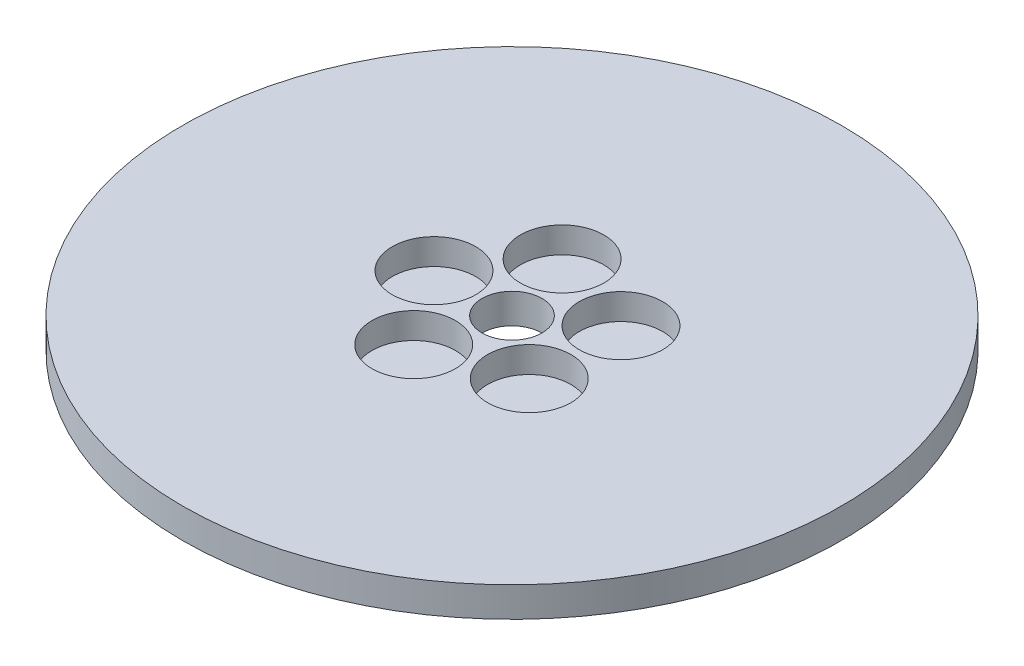
from build123d import *

# Parameters (mm, degrees)
SKETCH1_R           = 55
BOSS_EXTRUDE1_DEPTH = 5
SKETCH2_R           = 5
CUT_EXTRUDE1_DEPTH  = 78.942286341
SKETCH3_R           = 6.963007088
CUT_EXTRUDE2_DEPTH  = 4.327560043
CIRPATTERN1_COUNT   = 5


with BuildPart() as part:
    # Sketch1 → Boss-Extrude1 (new body)
    with BuildSketch(Plane(origin=(0, 0, 0), x_dir=(1, 0, 0), z_dir=(0, 1, 0))):
        Circle(SKETCH1_R)
    extrude(amount=BOSS_EXTRUDE1_DEPTH)

    # Sketch2 → Cut-Extrude1 (cut, through all)
    with BuildSketch(Plane(origin=(0, 0, 0), x_dir=(1, 0, 0), z_dir=(0, 1, 0))):
        Circle(SKETCH2_R)
    extrude(amount=CUT_EXTRUDE1_DEPTH, mode=Mode.SUBTRACT)

    # Sketch3 → Cut-Extrude2 (cut)
    with BuildSketch(Plane(origin=(0, 5, 0), x_dir=(1, 0, 0), z_dir=(0, 1, 0))):
        with Locations((-13.019008094, 0)):
            Circle(SKETCH3_R)
    cut_extrude2 = extrude(amount=-CUT_EXTRUDE2_DEPTH, mode=Mode.SUBTRACT)

    # CirPattern1: Cut-Extrude2 ×5 about axis
    cirpattern1_axis = Axis((0, 0, 0), (0, 1, 0))
    for i in range(1, CIRPATTERN1_COUNT):
        add(cut_extrude2.rotate(cirpattern1_axis, i * 360 / CIRPATTERN1_COUNT), mode=Mode.SUBTRACT)


solid = part.part
